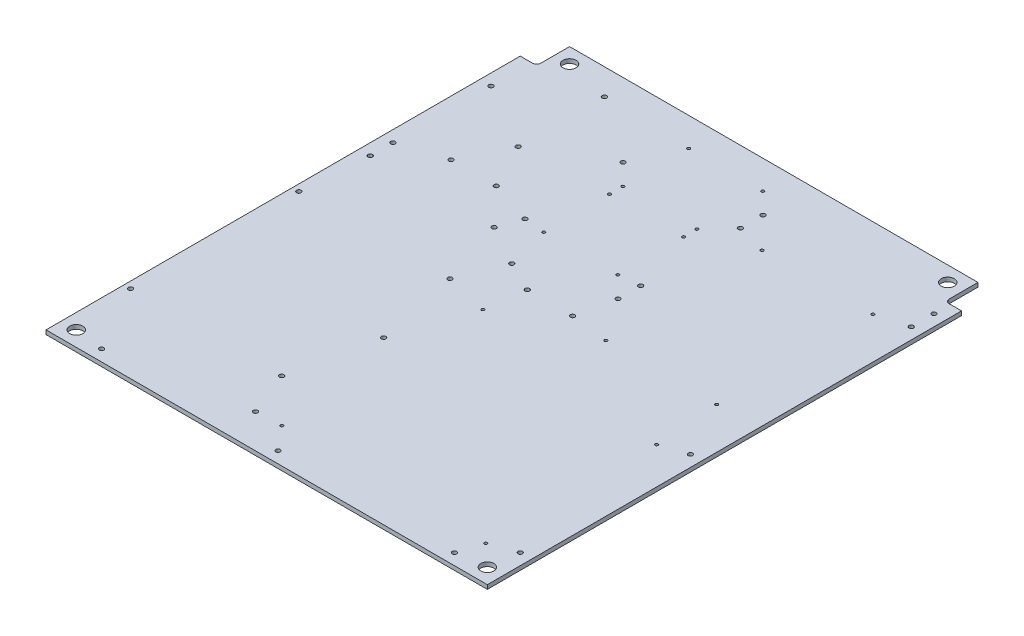
from build123d import *

# Parameters (mm, degrees)
SKETCH1_W               = 340.868
SKETCH1_H               = 391.668
BOSS_EXTRUDE1_DEPTH     = 3.175
CUT_EXTRUDE1_DEPTH      = 10
F_3_8_CLEARANCE_HOLE1_D = 10.0838
F_4_40_TAPPED_HOLE1_D   = 2.2606
F_8_32_TAPPED_HOLE1_D   = 3.4544
F_4_40_TAPPED_HOLE2_D   = 2.2606
F_8_32_TAPPED_HOLE2_D   = 3.4544


with BuildPart() as part:
    # Sketch1 → Boss-Extrude1 (new body)
    with BuildSketch(Plane(origin=(0, 0, 0), x_dir=(1, 0, 0), z_dir=(0, 1, 0))):
        Rectangle(SKETCH1_W, SKETCH1_H)
    extrude(amount=BOSS_EXTRUDE1_DEPTH)

    # Sketch2 → Cut-Extrude1 (cut)
    with BuildSketch(Plane(origin=(0, 3.175, 0), x_dir=(1, 0, 0), z_dir=(0, 1, 0))):
        with BuildLine():
            Line((-170.434, 195.834), (-157.734, 195.834))
            Line((-157.734, 195.834), (-157.734, 173.609))
            ThreePointArc((-157.734, 173.609), (-158.66393597, 171.36393597), (-160.909, 170.434))
            Line((-160.909, 170.434), (-170.434, 170.434))
            Line((-170.434, 170.434), (-170.434, 195.834))
        make_face()
        with BuildLine():
            Line((170.434, 195.834), (157.734, 195.834))
            Line((157.734, 195.834), (157.734, 173.609))
            ThreePointArc((157.734, 173.609), (158.66393597, 171.36393597), (160.909, 170.434))
            Line((160.909, 170.434), (170.434, 170.434))
            Line((170.434, 170.434), (170.434, 195.834))
        make_face()
    extrude(amount=-CUT_EXTRUDE1_DEPTH, mode=Mode.SUBTRACT)

    # 3/8 Clearance Hole1 (through all)
    with Locations(Plane(origin=(0, 3.175, 0), x_dir=(1, 0, 0), z_dir=(0, 1, 0))):
        with Locations((158.75, -184.15), (-158.75, -184.15), (-146.05, 184.15), (146.05, 184.15)):
            Hole(F_3_8_CLEARANCE_HOLE1_D / 2)

    # #4-40 Tapped Hole1 (through all)
    with Locations(Plane(origin=(0, 3.175, 0), x_dir=(1, 0, 0), z_dir=(0, 1, 0))):
        with Locations((-15.34, -13.51), (142.14, -36.73), (142.14, -168.81), (-15.34, -168.81), (-43.575, 61.759), (13.575, 61.759), (13.575, 112.559), (-43.575, 112.559), (-43.575, 122.909), (-43.575, 173.709), (13.575, 173.709), (13.575, 122.909)):
            Hole(F_4_40_TAPPED_HOLE1_D / 2)

    # #8-32 Tapped Hole1 (through all)
    with Locations(Plane(origin=(0, 3.175, 0), x_dir=(1, 0, 0), z_dir=(0, 1, 0))):
        with Locations((-165.334, -5.625), (-165.334, -135.625), (-48.634, -135.625), (-48.634, -5.625)):
            Hole(F_8_32_TAPPED_HOLE1_D / 2)

    # #4-40 Tapped Hole2 (through all)
    with Locations(Plane(origin=(0, 3.175, 0), x_dir=(1, 0, 0), z_dir=(0, 1, 0))):
        with Locations((138.509, 13.259), (52.859, 13.259), (138.509, 133.909), (52.859, 133.909)):
            Hole(F_4_40_TAPPED_HOLE2_D / 2)

    # #8-32 Tapped Hole2 (through all)
    with Locations(Plane(origin=(0, 3.175, 0), x_dir=(1, 0, 0), z_dir=(0, 1, 0))):
        with Locations((-127.822204925, 74.30826235), (-92.822204925, 74.30826235), (-59.684, 139.084), (-59.684, 63.334), (-161.684, 45.834), (-161.684, 63.334), (-161.684, 139.084), (29.684, 45.834), (29.684, 63.334), (29.684, 140.334), (29.684, 157.834), (161.684, 157.834), (161.684, 140.334), (161.684, -161.684), (161.684, -30.234842243), (136.284, -187.084), (0, -187.084), (-136.284, -187.084), (-34.884, -169.584), (-34.884, 28.334), (-34.884, -70.625), (-66, 45.834), (-110.684, 175.684), (-110.684, 109.084), (-11.384, 16.834), (23.616, 16.834)):
            Hole(F_8_32_TAPPED_HOLE2_D / 2)


solid = part.part
